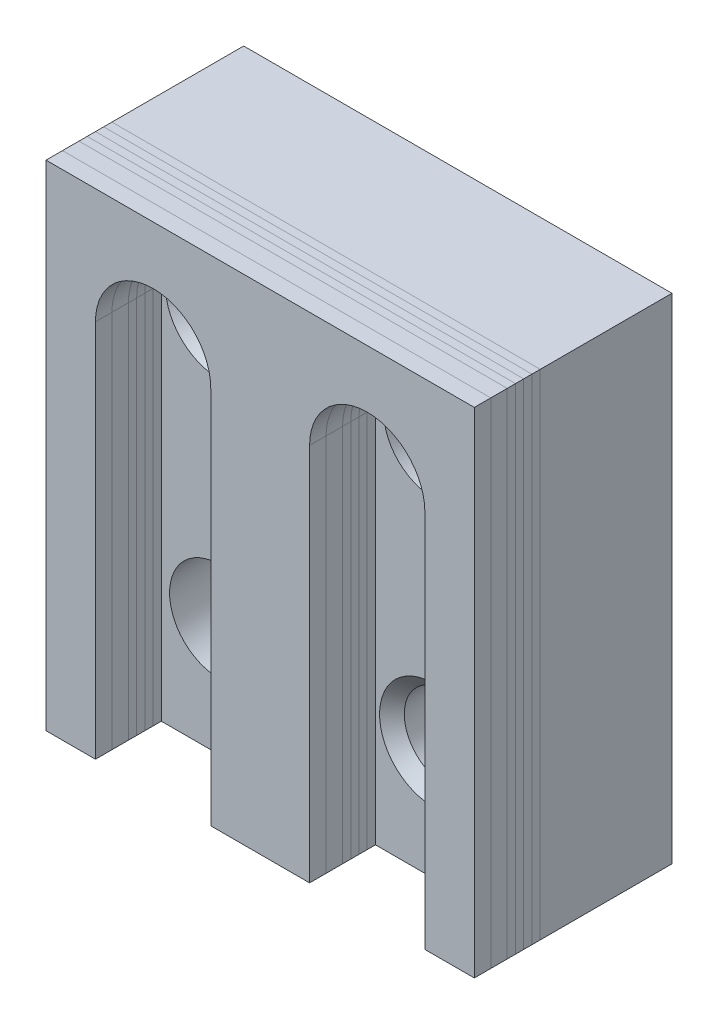
from build123d import *

# Parameters (mm, degrees)
SKETCH_1_W             = 26
SKETCH_1_H             = 30
EXTRUDE_654_DEPTH      = 8
SKETCH_2_R             = 3
CUT_EXTRUDE_976_DEPTH  = 22.400934559
M6X1_01_D              = 5
M6X1_01_CSINK_D        = 6.5
M6X1_01_CSINK_ANGLE    = 90
EXTRUDE_3_DEPTH        = 4
SPLIT_START            = 8
SPLIT_BODIES_1_DEPTH   = 3
SPLIT_START_2          = 10
SPLIT_BODIES_1_2_DEPTH = 1
SPLIT_START_3          = 9.5
SPLIT_BODIES_1_3_DEPTH = 0.5
SPLIT_START_4          = 9
SPLIT_BODIES_1_4_DEPTH = 0.5
SPLIT_START_5          = 8.5
SPLIT_BODIES_1_5_DEPTH = 0.5
SPLIT_BODIES_1_6_DEPTH = 0.5


# Read off the part's stored shape, not the designer's step: Разделить1
with BuildPart() as part:
    # Эскиз1 → Extrude 654 (new body)
    with BuildSketch(Plane.XY):
        Rectangle(SKETCH_1_W, SKETCH_1_H)
    extrude(amount=EXTRUDE_654_DEPTH)

    # Эскиз2 → Cut-Extrude 976 (cut, through all)
    with BuildSketch(Plane.XY.offset(8)):
        with Locations((-6.5, -8)):
            Circle(SKETCH_2_R)
        with Locations((6.5, 8)):
            Circle(SKETCH_2_R)
    extrude(amount=-CUT_EXTRUDE_976_DEPTH, mode=Mode.SUBTRACT)

    # Отверстие обработанное метчиком M6x1.01 (through all)
    with Locations(Plane(origin=(-6.5, 8, 8), x_dir=(1, 0, 0), z_dir=(0, 0, 1))):
        with Locations((0, 0), (13, -16)):
            CounterSinkHole(M6X1_01_D / 2, M6X1_01_CSINK_D / 2, counter_sink_angle=M6X1_01_CSINK_ANGLE)


with BuildPart() as body_2:
    # Эскиз4 → Вытянуть3 (new body)
    with BuildSketch(Plane.XY.offset(8)):
        with BuildLine():
            Line((-10, 8), (-10, -15))
            Line((-10, -15), (-13, -15))
            Line((-13, -15), (-13, 15))
            Line((-13, 15), (13, 15))
            Line((13, 15), (13, -15))
            Line((13, -15), (10, -15))
            Line((10, -15), (10, 8))
            ThreePointArc((10, 8), (6.5, 11.5), (3, 8))
            Line((3, 8), (3, -15))
            Line((3, -15), (-3, -15))
            Line((-3, -15), (-3, 8))
            ThreePointArc((-3, 8), (-6.5, 11.5), (-10, 8))
        make_face()
    extrude(amount=EXTRUDE_3_DEPTH)

    # Split Bodies 1 outline → Split Bodies 1 (cut)
    with BuildSketch(Plane.XY.offset(SPLIT_START)):
        with BuildLine():
            Line((10, -15), (13, -15))
            Line((13, -15), (13, 15))
            Line((13, 15), (-13, 15))
            Line((-13, 15), (-13, -15))
            Line((-13, -15), (-10, -15))
            Line((-10, -15), (-10, 8))
            ThreePointArc((-10, 8), (-6.5, 11.5), (-3, 8))
            Line((-3, 8), (-3, -15))
            Line((-3, -15), (3, -15))
            Line((3, -15), (3, 8))
            ThreePointArc((3, 8), (6.5, 11.5), (10, 8))
            Line((10, 8), (10, -15))
        make_face()
    extrude(amount=SPLIT_BODIES_1_DEPTH, mode=Mode.SUBTRACT)


with BuildPart() as body_3:
    # Split Bodies 1 2 outline → Split Bodies 1 2 (new body)
    with BuildSketch(Plane.XY.offset(SPLIT_START_2)):
        with BuildLine():
            Line((13, -15), (13, 15))
            Line((13, 15), (-13, 15))
            Line((-13, 15), (-13, -15))
            Line((-13, -15), (-10, -15))
            Line((-10, -15), (-10, 8))
            ThreePointArc((-10, 8), (-6.5, 11.5), (-3, 8))
            Line((-3, 8), (-3, -15))
            Line((-3, -15), (3, -15))
            Line((3, -15), (3, 8))
            ThreePointArc((3, 8), (6.5, 11.5), (10, 8))
            Line((10, 8), (10, -15))
            Line((10, -15), (13, -15))
        make_face()
    extrude(amount=SPLIT_BODIES_1_2_DEPTH)


with BuildPart() as body_4:
    # Split Bodies 1 3 outline → Split Bodies 1 3 (new body)
    with BuildSketch(Plane.XY.offset(SPLIT_START_3)):
        with BuildLine():
            Line((13, -15), (13, 15))
            Line((13, 15), (-13, 15))
            Line((-13, 15), (-13, -15))
            Line((-13, -15), (-10, -15))
            Line((-10, -15), (-10, 8))
            ThreePointArc((-10, 8), (-6.5, 11.5), (-3, 8))
            Line((-3, 8), (-3, -15))
            Line((-3, -15), (3, -15))
            Line((3, -15), (3, 8))
            ThreePointArc((3, 8), (6.5, 11.5), (10, 8))
            Line((10, 8), (10, -15))
            Line((10, -15), (13, -15))
        make_face()
    extrude(amount=SPLIT_BODIES_1_3_DEPTH)


with BuildPart() as body_5:
    # Split Bodies 1 4 outline → Split Bodies 1 4 (new body)
    with BuildSketch(Plane.XY.offset(SPLIT_START_4)):
        with BuildLine():
            Line((13, -15), (13, 15))
            Line((13, 15), (-13, 15))
            Line((-13, 15), (-13, -15))
            Line((-13, -15), (-10, -15))
            Line((-10, -15), (-10, 8))
            ThreePointArc((-10, 8), (-6.5, 11.5), (-3, 8))
            Line((-3, 8), (-3, -15))
            Line((-3, -15), (3, -15))
            Line((3, -15), (3, 8))
            ThreePointArc((3, 8), (6.5, 11.5), (10, 8))
            Line((10, 8), (10, -15))
            Line((10, -15), (13, -15))
        make_face()
    extrude(amount=SPLIT_BODIES_1_4_DEPTH)


with BuildPart() as body_6:
    # Split Bodies 1 5 outline → Split Bodies 1 5 (new body)
    with BuildSketch(Plane.XY.offset(SPLIT_START_5)):
        with BuildLine():
            Line((13, -15), (13, 15))
            Line((13, 15), (-13, 15))
            Line((-13, 15), (-13, -15))
            Line((-13, -15), (-10, -15))
            Line((-10, -15), (-10, 8))
            ThreePointArc((-10, 8), (-6.5, 11.5), (-3, 8))
            Line((-3, 8), (-3, -15))
            Line((-3, -15), (3, -15))
            Line((3, -15), (3, 8))
            ThreePointArc((3, 8), (6.5, 11.5), (10, 8))
            Line((10, 8), (10, -15))
            Line((10, -15), (13, -15))
        make_face()
    extrude(amount=SPLIT_BODIES_1_5_DEPTH)


with BuildPart() as body_7:
    # Split Bodies 1 6 outline → Split Bodies 1 6 (new body)
    with BuildSketch(Plane.XY.offset(SPLIT_START)):
        with BuildLine():
            Line((13, -15), (13, 15))
            Line((13, 15), (-13, 15))
            Line((-13, 15), (-13, -15))
            Line((-13, -15), (-10, -15))
            Line((-10, -15), (-10, 8))
            ThreePointArc((-10, 8), (-6.5, 11.5), (-3, 8))
            Line((-3, 8), (-3, -15))
            Line((-3, -15), (3, -15))
            Line((3, -15), (3, 8))
            ThreePointArc((3, 8), (6.5, 11.5), (10, 8))
            Line((10, 8), (10, -15))
            Line((10, -15), (13, -15))
        make_face()
    extrude(amount=SPLIT_BODIES_1_6_DEPTH)


solid = Compound([part.part, body_2.part, body_3.part, body_4.part, body_5.part, body_6.part, body_7.part])
